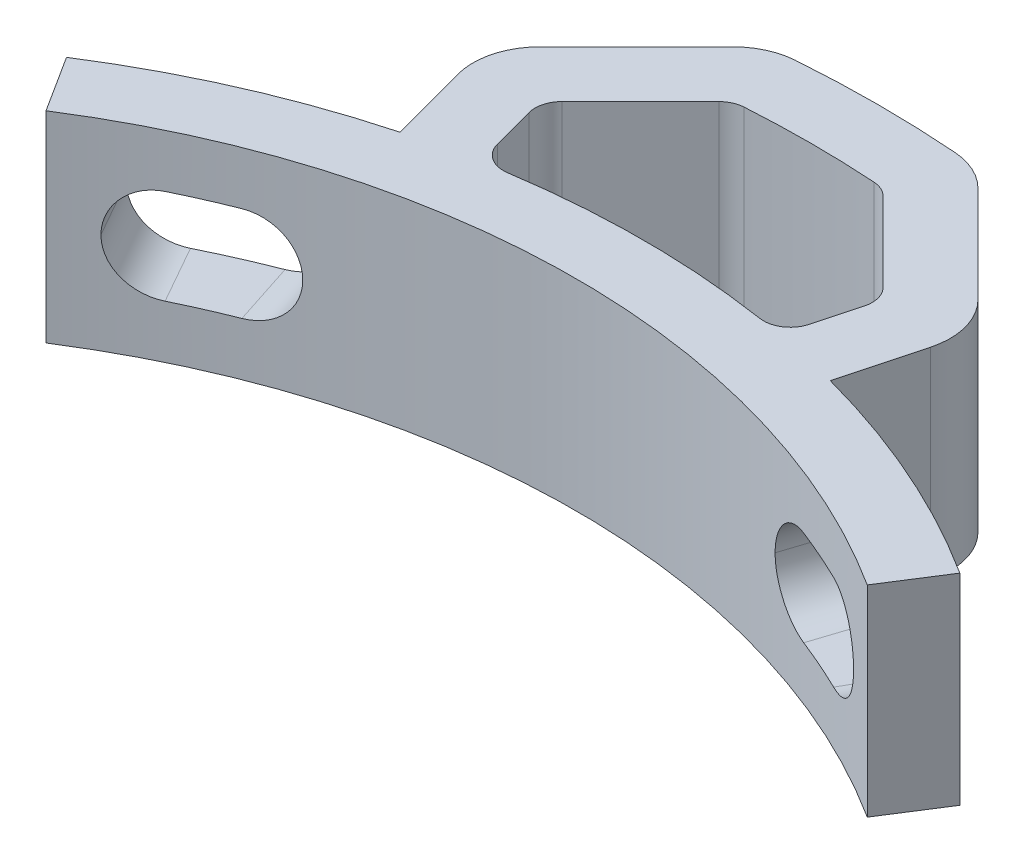
from build123d import *

# Parameters (mm, degrees)
BOSS_EXTRUDE1_DEPTH  = 4.7625
CHAMFER1_SIZE        = 5.3975
CUT_EXTRUDE1_DEPTH   = 2.25
FILLET1_R            = 2.25
FILLET1_OF_MIRROR1_R = 2.25
FILLET2_R            = 3.175
CUT_EXTRUDE2_DEPTH   = 56.557883235
FILLET3_R            = 1.27


# Some blends are built 0.0001 mm under size
with BuildPart() as part:
    # Sketch1 → Boss-Extrude1 (new, symmetric)
    with BuildSketch(Plane(origin=(0, 0, 0), x_dir=(1, 0, 0), z_dir=(0, 1, 0))):
        with BuildLine():
            Line((-19.447559324, 30.526553381), (-21.153485581, 33.204321222))
            ThreePointArc((-21.153485581, 33.204321222), (-15.85613718, 36.035812933), (-10.189705806, 38.028499781))
            Line((-10.189705806, 38.028499781), (-13.065832444, 48.762350526))
            ThreePointArc((-13.065832444, 48.762350526), (0, 50.4825), (13.065832444, 48.762350526))
            Line((13.065832444, 48.762350526), (10.189705806, 38.028499781))
            ThreePointArc((10.189705806, 38.028499781), (15.85613718, 36.035812933), (21.153485581, 33.204321222))
            Line((21.153485581, 33.204321222), (19.447559324, 30.526553381))
            ThreePointArc((19.447559324, 30.526553381), (0, 36.195), (-19.447559324, 30.526553381))
        make_face()
    extrude(amount=BOSS_EXTRUDE1_DEPTH, both=True)

    # Chamfer1
    # the kernel refuses this chamfer: 9.348744234, 5.3975 mm, written as the material it takes off along each edge
    with BuildSketch(Plane(origin=(-13.065832444, 26.081931668, -48.762350526), x_dir=(0.9837865219812311, 0, -0.17934346703482887), z_dir=(0, -1, 0))) as chamfer1_piece_1:
        with BuildLine():
            Line((8.217561706, 0), (CHAMFER1_SIZE * 0.0813902016187, CHAMFER1_SIZE * 0.99668231402))
            Line((CHAMFER1_SIZE * 0.0813902016187, CHAMFER1_SIZE * 0.99668231402), (0, 0))
            ThreePointArc((0, 0), (4.262745394, -0.167250297), (8.217561706, 0))
        make_face()
    extrude(amount=52.163863336, mode=Mode.SUBTRACT)
    with BuildSketch(Plane(origin=(13.065832444, -26.081931668, -48.762350526), x_dir=(-0.25881904510252207, 0, 0.965925826289068), z_dir=(0, 1, 0))) as chamfer1_piece_2:
        with BuildLine():
            Line((CHAMFER1_SIZE, 0), (0.668829004, -8.190298417))
            ThreePointArc((0.668829004, -8.190298417), (0.180250294, -4.262215479), (0, 0))
            Line((0, 0), (CHAMFER1_SIZE, 0))
        make_face()
    extrude(amount=52.163863336, mode=Mode.SUBTRACT)

    # Sketch2 → Cut-Extrude1 (cut, symmetric)
    with BuildSketch(Plane(origin=(0, 0, 0), x_dir=(1, 0, 0), z_dir=(0, 1, 0))):
        with BuildLine():
            Line((-12.165999069, 37.443095047), (-11.184870111, 34.423490607))
            ThreePointArc((-11.184870111, 34.423490607), (-14.577416439, 33.129698987), (-17.823270758, 31.502524415))
            Line((-17.823270758, 31.502524415), (-19.386715561, 34.265903749))
            ThreePointArc((-19.386715561, 34.265903749), (-15.85613718, 36.035812933), (-12.165999069, 37.443095047))
        make_face()
    cut_extrude1 = extrude(amount=CUT_EXTRUDE1_DEPTH, both=True, mode=Mode.SUBTRACT)

    # Fillet1
    fillet1_edges = [part.edges().sort_by_distance(p)[0] for p in [
        (-18.60499316, -2.25, -32.884214082),
        (-18.60499316, 2.25, -32.884214082),
        (-11.67543459, 2.25, -35.933292827),
        (-11.67543459, -2.25, -35.933292827),
    ]]
    fillet(fillet1_edges, radius=FILLET1_R - 0.0001)  # a hair under: the kernel refuses the full size

    # Mirror1: Cut-Extrude1 across plane
    add(cut_extrude1.mirror(Plane(origin=(0, 0, 0), x_dir=(0, 0, 1), z_dir=(1, 0, 0))), mode=Mode.SUBTRACT)

    # Fillet1 of Mirror1
    fillet1_of_mirror1_edges = [part.edges().sort_by_distance(p)[0] for p in [
        (18.60499316, -2.25, -32.884214082),
        (18.60499316, 2.25, -32.884214082),
        (11.67543459, 2.25, -35.933292827),
        (11.67543459, -2.25, -35.933292827),
    ]]
    fillet(fillet1_of_mirror1_edges, radius=FILLET1_OF_MIRROR1_R - 0.0001)  # a hair under: the kernel refuses the full size

    # Fillet2
    fillet2_edges = [part.edges().sort_by_distance(p)[0] for p in [
        (-11.668856648, 0, -43.548765878),
        (4.981505994, 0, -50.236116533),
        (-4.981505994, 0, -50.236116533),
        (11.668856648, 0, -43.548765878),
    ]]
    fillet(fillet2_edges, radius=FILLET2_R)

    # Sketch3 → Cut-Extrude2 (cut, through all)
    with BuildSketch(Plane(origin=(0, 4.7625, 0), x_dir=(1, 0, 0), z_dir=(0, 1, 0))):
        with BuildLine():
            Line((7.089702157, 38.726386655), (8.127604296, 42.59989017))
            Line((8.127604296, 42.59989017), (3.553655431, 47.173839035))
            ThreePointArc((3.553655431, 47.173839035), (0, 47.3075), (-3.553655431, 47.173839035))
            Line((-3.553655431, 47.173839035), (-8.127604296, 42.59989017))
            Line((-8.127604296, 42.59989017), (-7.089702157, 38.726386655))
            ThreePointArc((-7.089702157, 38.726386655), (0, 39.37), (7.089702157, 38.726386655))
        make_face()
    extrude(amount=-CUT_EXTRUDE2_DEPTH, mode=Mode.SUBTRACT)

    # Fillet3
    fillet3_edges = [part.edges().sort_by_distance(p)[0] for p in [
        (7.089702157, 0, -38.726386655),
        (-7.089702157, 0, -38.726386655),
        (-8.127604296, 0, -42.59989017),
        (-3.553655431, 0, -47.173839035),
        (3.553655431, 0, -47.173839035),
        (8.127604296, 0, -42.59989017),
    ]]
    fillet(fillet3_edges, radius=FILLET3_R)


solid = part.part
